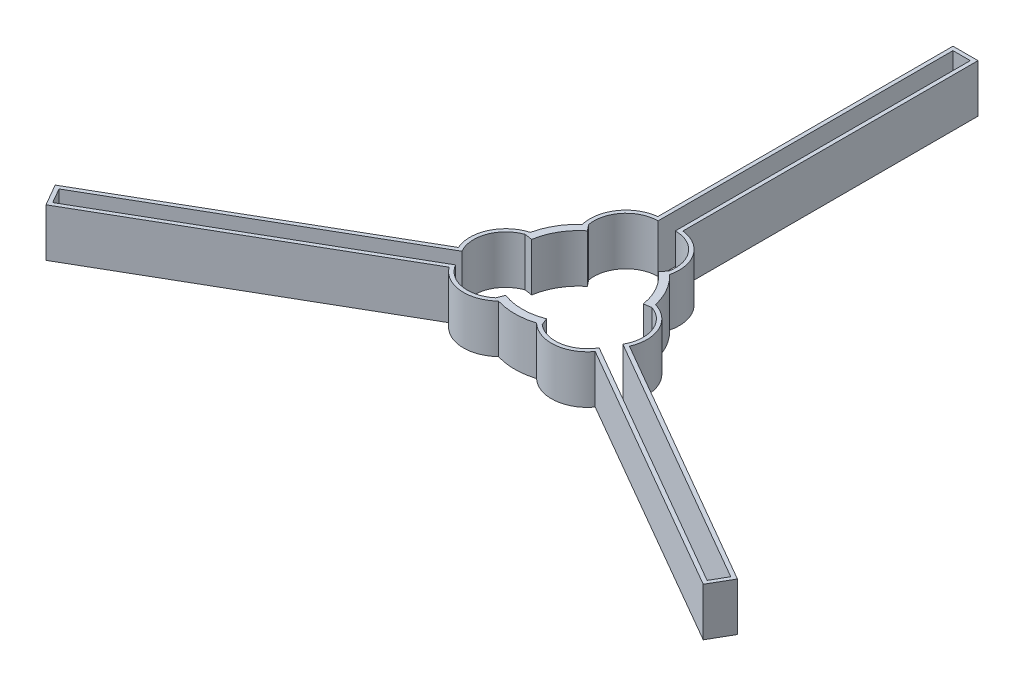
from build123d import *

# Parameters (mm, degrees)
BOSS_EXTRUDE1_DEPTH = 15


with BuildPart() as part:
    # Sketch1 → Boss-Extrude1 (new body)
    with BuildSketch(Plane(origin=(0, 0, 0), x_dir=(1, 0, 0), z_dir=(0, 1, 0))):
        with BuildLine():
            ThreePointArc((26.655274179, -10.886097623), (26.558231496, -1.615586887), (19.508708805, 4.405710019))
            ThreePointArc((19.508708805, 4.405710019), (17.320508076, 10), (13.5698112, 14.692182411))
            ThreePointArc((13.5698112, 14.692182411), (11.879976462, 23.807896598), (3.9, 28.527193396))
            Line((3.9, 28.527193396), (3.9, 120.5))
            Line((3.9, 120.5), (-3.9, 120.5))
            Line((-3.9, 120.5), (-3.9, 28.527193396))
            ThreePointArc((-3.9, 28.527193396), (-11.879976462, 23.807896598), (-13.5698112, 14.692182411))
            ThreePointArc((-13.5698112, 14.692182411), (-17.320508076, 10), (-19.508708805, 4.405710019))
            ThreePointArc((-19.508708805, 4.405710019), (-26.558231496, -1.615586887), (-26.655274179, -10.886097623))
            Line((-26.655274179, -10.886097623), (-106.306061156, -56.872500925))
            Line((-106.306061156, -56.872500925), (-102.406061156, -63.627499075))
            Line((-102.406061156, -63.627499075), (-22.755274179, -17.641095773))
            ThreePointArc((-22.755274179, -17.641095773), (-14.678255034, -22.192309712), (-5.938897605, -19.097892429))
            ThreePointArc((-5.938897605, -19.097892429), (0, -20), (5.938897605, -19.097892429))
            ThreePointArc((5.938897605, -19.097892429), (14.678255034, -22.192309712), (22.755274179, -17.641095773))
            Line((22.755274179, -17.641095773), (102.406061156, -63.627499075))
            Line((102.406061156, -63.627499075), (106.306061156, -56.872500925))
            Line((106.306061156, -56.872500925), (26.655274179, -10.886097623))
        make_face()
        with BuildLine():
            ThreePointArc((19.763935841, 3.063795044), (25.796149809, -2.903484355), (25.071877456, -11.357563745))
            Line((25.071877456, -11.357563745), (104.666830671, -57.31173141))
            Line((104.666830671, -57.31173141), (101.966830671, -61.98826859))
            Line((101.966830671, -61.98826859), (22.371877456, -16.034100925))
            ThreePointArc((22.371877456, -16.034100925), (15.412566115, -20.888378877), (7.228643581, -18.647968039))
            Line((7.228643581, -18.647968039), (6.361206351, -16.410211874))
            ThreePointArc((6.361206351, -16.410211874), (0, -17.6), (-6.361206351, -16.410211874))
            Line((-6.361206351, -16.410211874), (-7.228643581, -18.647968039))
            ThreePointArc((-7.228643581, -18.647968039), (-15.412566115, -20.888378877), (-22.371877456, -16.034100925))
            Line((-22.371877456, -16.034100925), (-101.966830671, -61.98826859))
            Line((-101.966830671, -61.98826859), (-104.666830671, -57.31173141))
            Line((-104.666830671, -57.31173141), (-25.071877456, -11.357563745))
            ThreePointArc((-25.071877456, -11.357563745), (-25.796149809, -2.903484355), (-19.763935841, 3.063795044))
            Line((-19.763935841, 3.063795044), (-17.39226354, 2.696139638))
            ThreePointArc((-17.39226354, 2.696139638), (-15.242047107, 8.8), (-11.031057189, 13.714072236))
            Line((-11.031057189, 13.714072236), (-12.53529226, 15.584172995))
            ThreePointArc((-12.53529226, 15.584172995), (-10.383583693, 23.791863232), (-2.7, 27.39166467))
            Line((-2.7, 27.39166467), (-2.7, 119.3))
            Line((-2.7, 119.3), (2.7, 119.3))
            Line((2.7, 119.3), (2.7, 27.39166467))
            ThreePointArc((2.7, 27.39166467), (10.383583693, 23.791863232), (12.53529226, 15.584172995))
            Line((12.53529226, 15.584172995), (11.031057189, 13.714072236))
            ThreePointArc((11.031057189, 13.714072236), (15.242047107, 8.8), (17.39226354, 2.696139638))
            Line((17.39226354, 2.696139638), (19.763935841, 3.063795044))
        make_face(mode=Mode.SUBTRACT)
    extrude(amount=BOSS_EXTRUDE1_DEPTH)


solid = part.part
